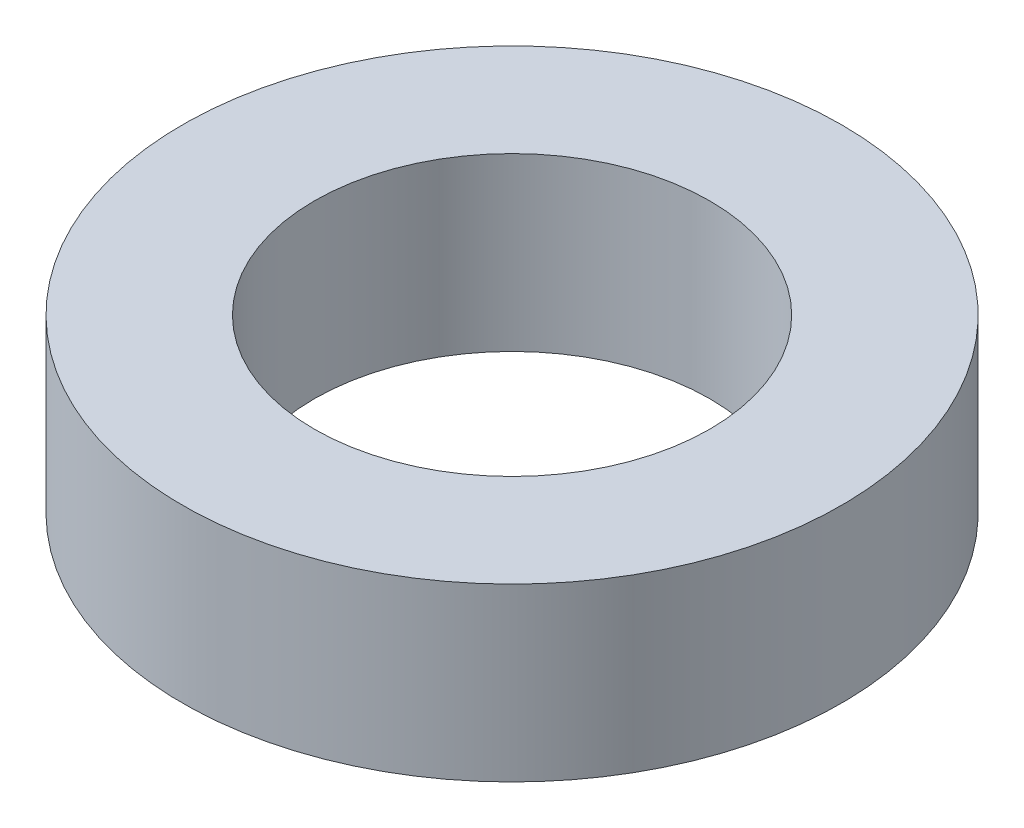
from build123d import *

# Parameters (mm, degrees)
SKETCH1_R           = 50
BOSS_EXTRUDE1_DEPTH = 26
SKETCH2_R           = 30
CUT_EXTRUDE1_DEPTH  = 76.339232807


with BuildPart() as part:
    # Sketch1 → Boss-Extrude1 (new body)
    with BuildSketch(Plane(origin=(0, 0, 0), x_dir=(1, 0, 0), z_dir=(0, 1, 0))):
        Circle(SKETCH1_R)
    extrude(amount=BOSS_EXTRUDE1_DEPTH)

    # Sketch2 → Cut-Extrude1 (cut, through all)
    with BuildSketch(Plane(origin=(0, 0, 0), x_dir=(1, 0, 0), z_dir=(0, 1, 0))):
        Circle(SKETCH2_R)
    extrude(amount=CUT_EXTRUDE1_DEPTH, mode=Mode.SUBTRACT)


solid = part.part
